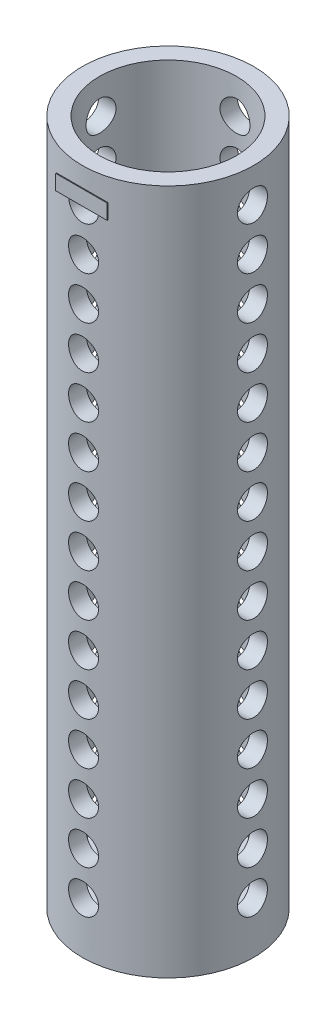
from build123d import *

# Parameters (mm, degrees)
SKETCH1_R           = 10
SKETCH1_R_2         = 8
BOSS_EXTRUDE1_DEPTH = 80
SKETCH2_R           = 1.75
CUT_EXTRUDE1_DEPTH  = 10
CIRPATTERN1_COUNT   = 4
SKETCH3_R           = 8
BOSS_EXTRUDE2_DEPTH = 4
SKETCH4_R           = 1.75
CUT_EXTRUDE2_DEPTH  = 5
SKETCH6_W           = 6
SKETCH6_H           = 1.75
BOSS_EXTRUDE3_DEPTH = 0.1


with BuildPart() as part:
    # Sketch1 → Boss-Extrude1 (new body)
    with BuildSketch(Plane(origin=(0, 0, 0), x_dir=(1, 0, 0), z_dir=(0, 1, 0))):
        Circle(SKETCH1_R)
        Circle(SKETCH1_R_2, mode=Mode.SUBTRACT)
    extrude(amount=BOSS_EXTRUDE1_DEPTH)

    # Sketch2 → Cut-Extrude1 (cut, symmetric)
    with BuildSketch(Plane.XY):
        with Locations((0, 76)):
            Circle(SKETCH2_R)
        with Locations((0, 71)):
            Circle(SKETCH2_R)
        with Locations((0, 66)):
            Circle(SKETCH2_R)
        with Locations((0, 61)):
            Circle(SKETCH2_R)
        with Locations((0, 56)):
            Circle(SKETCH2_R)
        with Locations((0, 51)):
            Circle(SKETCH2_R)
        with Locations((0, 46)):
            Circle(SKETCH2_R)
        with Locations((0, 41)):
            Circle(SKETCH2_R)
        with Locations((0, 36)):
            Circle(SKETCH2_R)
        with Locations((0, 31)):
            Circle(SKETCH2_R)
        with Locations((0, 26)):
            Circle(SKETCH2_R)
        with Locations((0, 21)):
            Circle(SKETCH2_R)
        with Locations((0, 16)):
            Circle(SKETCH2_R)
        with Locations((0, 11)):
            Circle(SKETCH2_R)
        with Locations((0, 6)):
            Circle(SKETCH2_R)
    cut_extrude1 = extrude(amount=CUT_EXTRUDE1_DEPTH, both=True, mode=Mode.SUBTRACT)

    # CirPattern1: Cut-Extrude1 ×4 about axis
    cirpattern1_axis = Axis((0, 80, 0), (0, 1, 0))
    for i in range(1, CIRPATTERN1_COUNT):
        add(cut_extrude1.rotate(cirpattern1_axis, i * 360 / CIRPATTERN1_COUNT), mode=Mode.SUBTRACT)

    # Sketch3 → Boss-Extrude2 (add)
    with BuildSketch(Plane.XZ):
        Circle(SKETCH3_R)
    extrude(amount=-BOSS_EXTRUDE2_DEPTH)

    # Sketch4 → Cut-Extrude2 (cut)
    with BuildSketch(Plane.XZ):
        Circle(SKETCH4_R)
    extrude(amount=-CUT_EXTRUDE2_DEPTH, mode=Mode.SUBTRACT)


with BuildPart() as body_2:
    # Sketch6 → Boss-Extrude3 (new body)
    with BuildSketch(Plane.XY.offset(10)):
        with Locations((0, 76.875)):
            Rectangle(SKETCH6_W, SKETCH6_H)
    extrude(amount=BOSS_EXTRUDE3_DEPTH)


solid = Compound([part.part, body_2.part])
